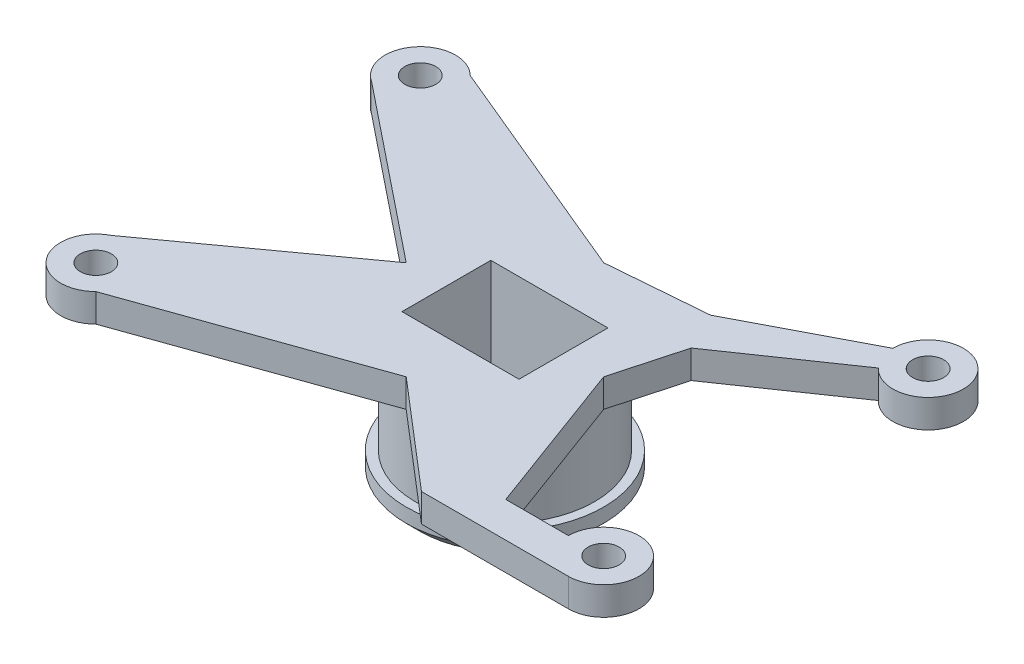
from build123d import *

# Parameters (mm, degrees)
SKETCH1_R                  = 6.35
BOSS_EXTRUDE1_DEPTH        = 5
SKETCH2_R                  = 7
BOSS_EXTRUDE2_DEPTH        = 2
BOSS_EXTRUDE3_START        = -7
SKETCH2_2_R                = 7
BOSS_EXTRUDE3_DEPTH        = 2
CHAMFER1_SIZE              = 1
SKETCH3_W                  = 8.3
SKETCH3_H                  = 6.3
CUT_EXTRUDE1_DEPTH         = 14.37908816
BOSS_EXTRUDE4_DEPTH        = 1
BOSS_EXTRUDE4_DEPTH_BACK   = 1
SKETCH6_R                  = 2.5
SKETCH6_R_2                = 1.1
BOSS_EXTRUDE4_2_DEPTH      = 1
BOSS_EXTRUDE4_2_DEPTH_BACK = 1
BOSS_EXTRUDE4_3_DEPTH      = 1
BOSS_EXTRUDE4_3_DEPTH_BACK = 1
BOSS_EXTRUDE4_4_DEPTH      = 1
BOSS_EXTRUDE4_4_DEPTH_BACK = 1
SKETCH7_W                  = 8.3
SKETCH7_H                  = 6.3
BOSS_EXTRUDE5_DEPTH        = 2


with BuildPart() as part:
    # Sketch1 → Boss-Extrude1 (new body)
    with BuildSketch(Plane(origin=(0, 0, 0), x_dir=(1, 0, 0), z_dir=(0, 1, 0))):
        with Locations(Location((0, 0, 0), (0, 0, 270))):
            Circle(SKETCH1_R)
    extrude(amount=-BOSS_EXTRUDE1_DEPTH)

    # Sketch2 → Boss-Extrude2 (add)
    with BuildSketch(Plane(origin=(0, 0, 0), x_dir=(1, 0, 0), z_dir=(0, 1, 0))):
        with Locations(Location((0, 0, 0), (0, 0, 270))):
            Circle(SKETCH2_R)
    extrude(amount=BOSS_EXTRUDE2_DEPTH)

    # Sketch2<2> → Boss-Extrude3 (add)
    with BuildSketch(Plane(origin=(0, 0, 0), x_dir=(1, 0, 0), z_dir=(0, 1, 0)).offset(BOSS_EXTRUDE3_START)):
        with Locations(Location((0, 0, 0), (0, 0, 270))):
            Circle(SKETCH2_2_R)
    extrude(amount=BOSS_EXTRUDE3_DEPTH)

    # Chamfer1
    # the kernel refuses this chamfer: 1 mm, written as the material it takes off along each edge
    with BuildSketch(Plane(origin=(0, 0, 0), x_dir=(0, 0, 1), z_dir=(-1, 0, 0))) as chamfer1_piece_1_section:
        Polygon((7 - CHAMFER1_SIZE, 0), (7, CHAMFER1_SIZE), (7, 0), align=None)
    chamfer1_piece_1 = revolve(axis=Axis((0, 0, 0), (0, 1, 0)), mode=Mode.PRIVATE)
    chamfer1_piece_1 = chamfer1_piece_1 - Plane(origin=(0, 0.669896582, 0), x_dir=(0, 0, 1), z_dir=(0, 1, 0)) * Cylinder(6.35, 28, mode=Mode.PRIVATE)
    add(chamfer1_piece_1, mode=Mode.SUBTRACT)
    with BuildSketch(Plane(origin=(0, -7, 0), x_dir=(0, 0, 1), z_dir=(-1, 0, 0))) as chamfer1_piece_2:
        Polygon((7, CHAMFER1_SIZE), (7 - CHAMFER1_SIZE, 0), (7, 0), align=None)
    revolve(axis=Axis((0, -7, 0), (0, 1, 0)), mode=Mode.SUBTRACT)

    # Sketch3 → Cut-Extrude1 (cut, through all)
    with BuildSketch(Plane.XZ.offset(7)):
        Rectangle(SKETCH3_W, SKETCH3_H)
    extrude(amount=-CUT_EXTRUDE1_DEPTH, mode=Mode.SUBTRACT)



with BuildPart() as body_2:
    # Sketch6 → Boss-Extrude4 (new, two sides: drawn at the far end of the back side and taken through both)
    with BuildSketch(Plane(origin=(0, 2, 0), x_dir=(1, 0, 0), z_dir=(0, 1, 0)).offset(-BOSS_EXTRUDE4_DEPTH_BACK)):
        with Locations(Location((-18, -11, 0), (0, 0, 270))):
            Circle(SKETCH6_R)
        with Locations(Location((-18, -11, 0), (0, 0, 270))):
            Circle(SKETCH6_R_2, mode=Mode.SUBTRACT)
    extrude(amount=BOSS_EXTRUDE4_DEPTH + BOSS_EXTRUDE4_DEPTH_BACK)


with BuildPart() as body_3:
    # Sketch6 → Boss-Extrude4 2 (new, two sides: drawn at the far end of the back side and taken through both)
    with BuildSketch(Plane(origin=(0, 2, 0), x_dir=(1, 0, 0), z_dir=(0, 1, 0)).offset(-BOSS_EXTRUDE4_2_DEPTH_BACK)):
        with Locations(Location((18, -11, 0), (0, 0, 270))):
            Circle(SKETCH6_R)
        with Locations(Location((18, -11, 0), (0, 0, 270))):
            Circle(SKETCH6_R_2, mode=Mode.SUBTRACT)
    extrude(amount=BOSS_EXTRUDE4_2_DEPTH + BOSS_EXTRUDE4_2_DEPTH_BACK)


with BuildPart() as body_4:
    # Sketch6 → Boss-Extrude4 3 (new, two sides: drawn at the far end of the back side and taken through both)
    with BuildSketch(Plane(origin=(0, 2, 0), x_dir=(1, 0, 0), z_dir=(0, 1, 0)).offset(-BOSS_EXTRUDE4_3_DEPTH_BACK)):
        with Locations(Location((18, 12, 0), (0, 0, 270))):
            Circle(SKETCH6_R)
        with Locations(Location((18, 12, 0), (0, 0, 270))):
            Circle(SKETCH6_R_2, mode=Mode.SUBTRACT)
    extrude(amount=BOSS_EXTRUDE4_3_DEPTH + BOSS_EXTRUDE4_3_DEPTH_BACK)


with BuildPart() as body_5:
    # Sketch6 → Boss-Extrude4 4 (new, two sides: drawn at the far end of the back side and taken through both)
    with BuildSketch(Plane(origin=(0, 2, 0), x_dir=(1, 0, 0), z_dir=(0, 1, 0)).offset(-BOSS_EXTRUDE4_4_DEPTH_BACK)):
        with Locations(Location((-18, 12, 0), (0, 0, 270))):
            Circle(SKETCH6_R)
        with Locations(Location((-18, 12, 0), (0, 0, 270))):
            Circle(SKETCH6_R_2, mode=Mode.SUBTRACT)
    extrude(amount=BOSS_EXTRUDE4_4_DEPTH + BOSS_EXTRUDE4_4_DEPTH_BACK)


with BuildPart() as part_1:
    add(part.part)

    add(body_2.part)  # Boss-Extrude5 merges body 2

    add(body_3.part)  # Boss-Extrude5 merges body 3

    add(body_4.part)  # Boss-Extrude5 merges body 4

    add(body_5.part)  # Boss-Extrude5 merges body 5
    # Sketch7 → Boss-Extrude5 (add)
    with BuildSketch(Plane(origin=(0, 3, 0), x_dir=(1, 0, 0), z_dir=(0, 1, 0))):
        Polygon((-19.767766953, 10.232233047), (-16.232233047, 10.232233047), (-16.232233047, 13.767766953), (0, 7), (7, 7.572180743), (15.5, 12), (16.192434296, 10.272948691), (8.334514261, 4.869137674), (7, 0), (11.058001897, -11), (15.5, -11), (18, -13.5), (7.583003583, -13.5), (0, -7), (-16.232233047, -12.767766953), (-16.232233047, -9.232233047), (-19.767766953, -9.232233047), (-7, 0), align=None)
        Rectangle(SKETCH7_W, SKETCH7_H, mode=Mode.SUBTRACT)
    extrude(amount=-BOSS_EXTRUDE5_DEPTH)


solid = part_1.part
